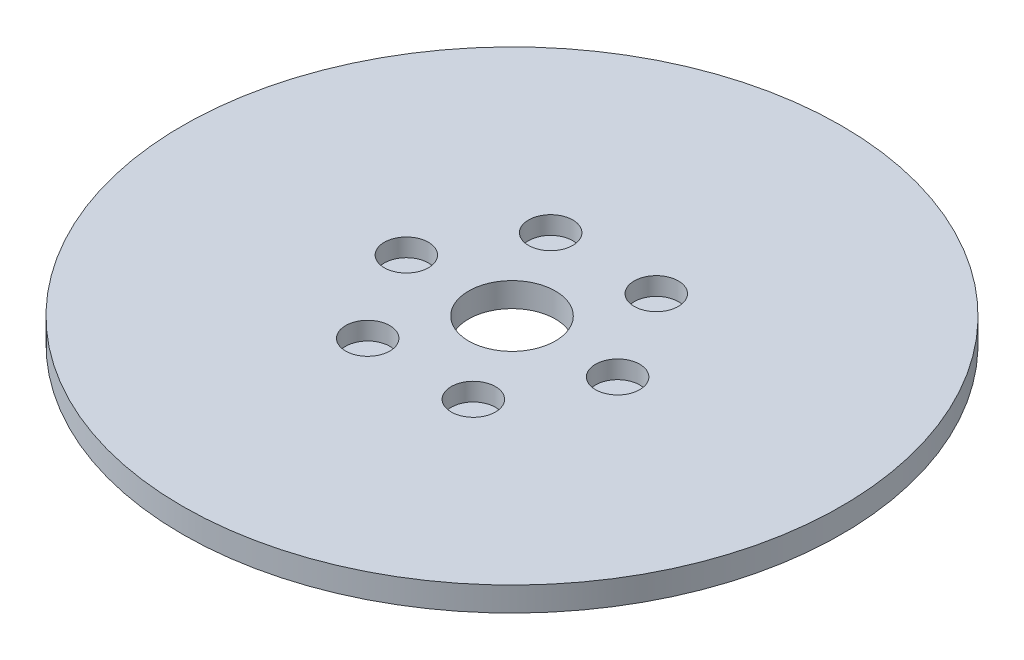
from build123d import *

# Parameters (mm, degrees)
SKETCH1_R           = 95
BOSS_EXTRUDE1_DEPTH = 7
SKETCH2_R           = 12.5
CUT_EXTRUDE1_DEPTH  = 135.532523949
SKETCH3_R           = 6.369607195
CUT_EXTRUDE2_DEPTH  = 5.179627619
CIRPATTERN1_COUNT   = 6


with BuildPart() as part:
    # Sketch1 → Boss-Extrude1 (new body)
    with BuildSketch(Plane(origin=(0, 0, 0), x_dir=(1, 0, 0), z_dir=(0, 1, 0))):
        Circle(SKETCH1_R)
    extrude(amount=BOSS_EXTRUDE1_DEPTH)

    # Sketch2 → Cut-Extrude1 (cut, through all)
    with BuildSketch(Plane(origin=(0, 0, 0), x_dir=(1, 0, 0), z_dir=(0, 1, 0))):
        Circle(SKETCH2_R)
    extrude(amount=CUT_EXTRUDE1_DEPTH, mode=Mode.SUBTRACT)

    # Sketch3 → Cut-Extrude2 (cut)
    with BuildSketch(Plane(origin=(0, 7, 0), x_dir=(1, 0, 0), z_dir=(0, 1, 0))):
        with Locations((-30.446447507, 0)):
            Circle(SKETCH3_R)
    cut_extrude2 = extrude(amount=-CUT_EXTRUDE2_DEPTH, mode=Mode.SUBTRACT)

    # CirPattern1: Cut-Extrude2 ×6 about axis
    cirpattern1_axis = Axis((0, 0, 0), (0, 1, 0))
    for i in range(1, CIRPATTERN1_COUNT):
        add(cut_extrude2.rotate(cirpattern1_axis, i * 360 / CIRPATTERN1_COUNT), mode=Mode.SUBTRACT)


solid = part.part
